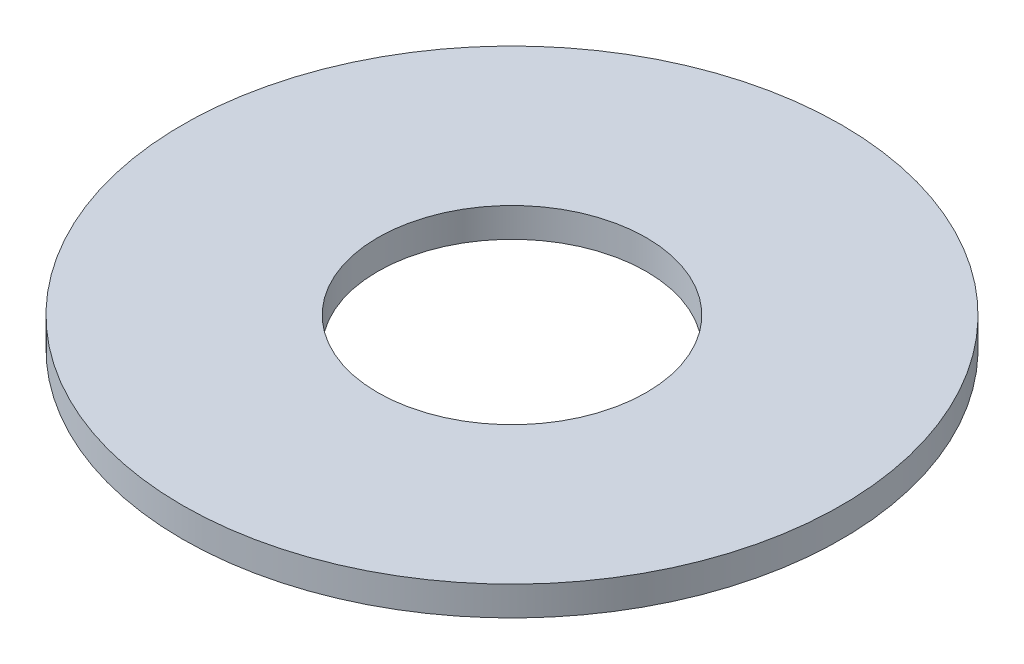
from build123d import *

# Parameters (mm, degrees)
SKETCH1_R           = 67.5
BOSS_EXTRUDE1_DEPTH = 6
SKETCH2_R           = 27.5
CUT_EXTRUDE1_DEPTH  = 96.647791402


with BuildPart() as part:
    # Sketch1 → Boss-Extrude1 (new body)
    with BuildSketch(Plane(origin=(0, 0, 0), x_dir=(1, 0, 0), z_dir=(0, 1, 0))):
        Circle(SKETCH1_R)
    extrude(amount=BOSS_EXTRUDE1_DEPTH)

    # Sketch2 → Cut-Extrude1 (cut, through all)
    with BuildSketch(Plane(origin=(0, 0, 0), x_dir=(1, 0, 0), z_dir=(0, 1, 0))):
        Circle(SKETCH2_R)
    extrude(amount=CUT_EXTRUDE1_DEPTH, mode=Mode.SUBTRACT)


solid = part.part
